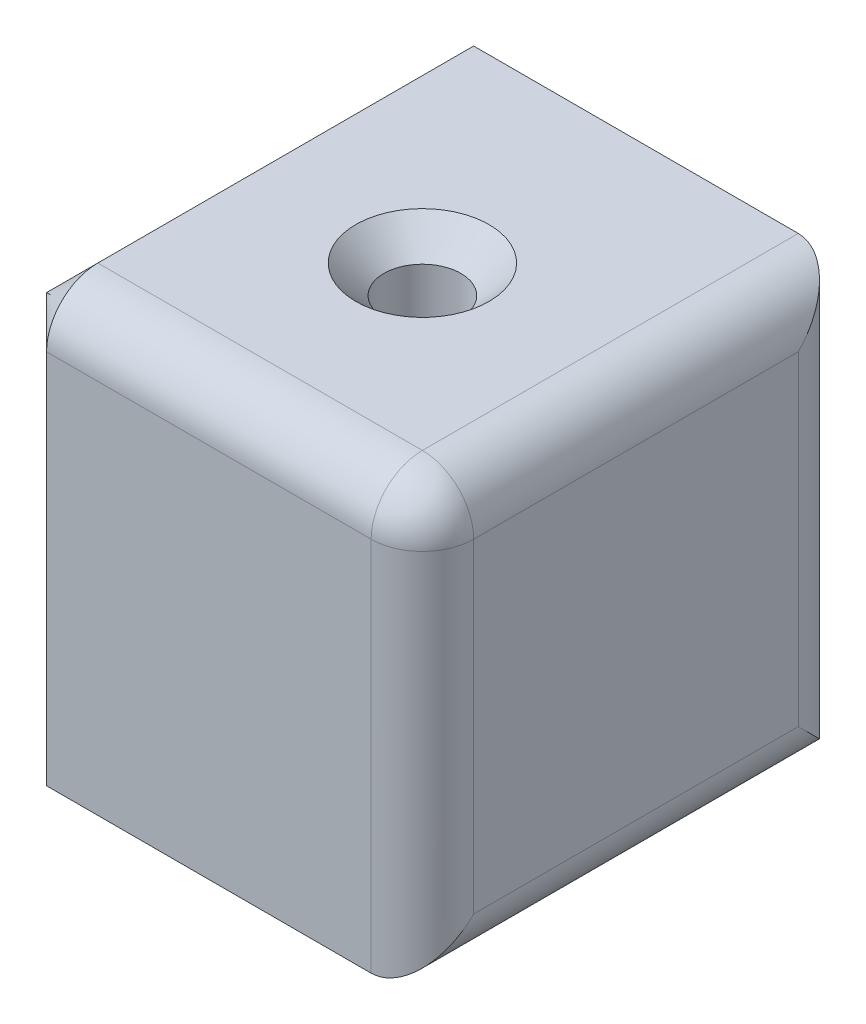
from build123d import *

# Parameters (mm, degrees)
SKETCH_1_W       = 25
SKETCH_1_H       = 25
EXTRUDE_1_DEPTH  = 25
FILLET_1_R       = 3
CHAMFER_1_SIZE   = 3
FILLET_1_2_DEPTH = 25


with BuildPart() as part:
    # 草图1 → 凸台-拉伸1 (new body)
    with BuildSketch(Plane.XY):
        with Locations((12.5, 12.5)):
            Rectangle(SKETCH_1_W, SKETCH_1_H)
    extrude(amount=EXTRUDE_1_DEPTH)

    # 草图2 → 切除-旋转1 (revolve, cut)
    with BuildSketch(Plane.XY.offset(12.5), mode=Mode.PRIVATE) as cut_revolve_1_sk:
        Polygon((10.25, 0), (10.25, 23.35), (8.6, 25), (12.5, 25), (12.5, 0), align=None)
    revolve(cut_revolve_1_sk.sketch.rotate(Axis((12.5, 25, 12.5), (0, -1, 0)), 270), axis=Axis((12.5, 25, 12.5), (0, -1, 0)), mode=Mode.SUBTRACT)

    # Fillet 1
    fillet_1_edges = [part.edges().sort_by_distance(p)[0] for p in [
        (25, 12.5, 25),
        (12.5, 25, 25),
        (25, 12.5, 0),
        (25, 25, 12.5),
        (25, 0, 12.5),
    ]]
    fillet(fillet_1_edges, radius=FILLET_1_R)

    # 倒角1
    chamfer_1_edges = [part.edges().sort_by_distance(p)[0] for p in [
        (0, 11, 25),
        (0, 25, 11),
        (0, 24.121320344, 24.121320344),
        (0, 12.5, 0),
        (0, 0, 12.5),
    ]]
    chamfer(chamfer_1_edges, length=CHAMFER_1_SIZE)

    # Fillet 1 2: read off the stored shape, not the designer's step
    # Fillet 1 2 outline → Fillet 1 2 (cut)
    with BuildSketch(Plane(origin=(0, 0, 0), x_dir=(1, 0, 0), z_dir=(0, 1, 0))):
        with BuildLine():
            ThreePointArc((0, -4.656854249), (0.30448187, -3.12612052), (1.171572875, -1.828427125))
            Line((1.171572875, -1.828427125), (0, -3))
            Line((0, -3), (0, -4.656854249))
        make_face()
    extrude(amount=FILLET_1_2_DEPTH, mode=Mode.SUBTRACT)


solid = part.part
